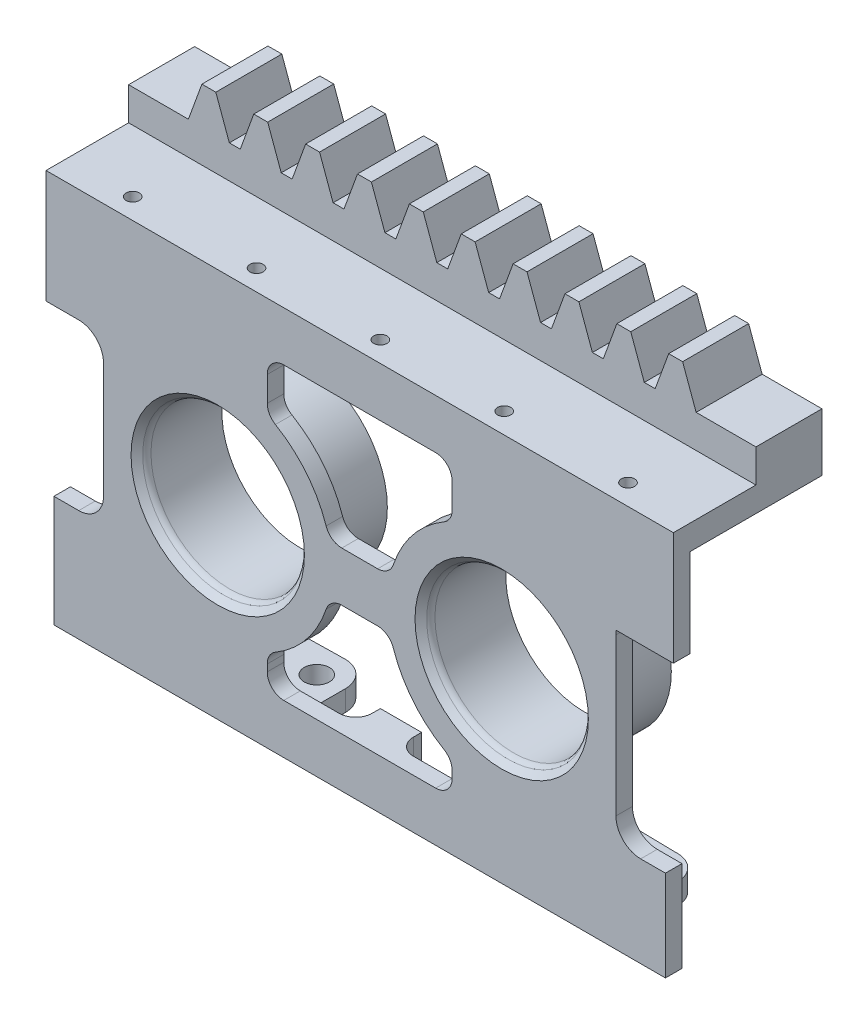
from build123d import *

# Parameters (mm, degrees)
SKETCH1_W              = 213.628300444
SKETCH1_H              = 8
EXTRUDE1_DEPTH         = 8
EXTRUDE2_DEPTH         = 8
LPATTERN1_COUNT        = 34
LPATTERN1_PITCH        = 6.283185307
SKETCH_1_W             = 139.55181824
SKETCH_1_H             = 28
CUT_EXTRUDE_1_DEPTH    = 10
SKETCH_2_W             = 4.961443825
SKETCH_2_H             = 8
CUT_EXTRUDE_2_DEPTH    = 10
SKETCH_3_W             = 74.076482204
SKETCH_3_H             = 1
CUT_EXTRUDE_3_DEPTH    = 10
SKETCH_4_W             = 74.076482204
SKETCH_4_H             = 2
EXTRUDE_1_DEPTH        = 8
SKETCH_5_W             = 74.076482204
SKETCH_5_H             = 45.4
EXTRUDE_2_DEPTH        = 2
SKETCH_6_R             = 1.525
EXTRUDE_3_DEPTH        = 1.7
SKETCH_7_R             = 10.55
SKETCH_7_R_2           = 9.5
EXTRUDE_4_DEPTH        = 10
CUT_EXTRUDE_START      = -7
SKETCH_8_R             = 9.5
CUT_EXTRUDE_4_DEPTH    = 7
SKETCH_9_W             = 12
SKETCH_9_H             = 20
SKETCH_9_H_2           = 25
CUT_EXTRUDE_5_DEPTH    = 7
FILLET_1_R             = 3
EXTRUDE_START          = 0.8
SKETCH_13_R            = 1.525
EXTRUDE_7_DEPTH        = 0.8
EXTRUDE_8_DEPTH        = 75.038241102
EXTRUDE_9_DEPTH        = 75.038241102
SKETCH_16_W            = 76
SKETCH_16_H            = 10
EXTRUDE_10_DEPTH       = 1
SKETCH_17_W            = 5
SKETCH_17_H            = 5
EXTRUDE_11_DEPTH       = 6
HOLE_WIZARD_M2_1_D     = 1.6
HOLE_WIZARD_M2_1_DEPTH = 5.2
HOLE_WIZARD_M2_1_TIP   = 0.480688495
FILLET_3_R             = 2
HOLE_WIZARD_M2_2_D     = 1.6
HOLE_WIZARD_M2_2_DEPTH = 5.2
HOLE_WIZARD_M2_2_TIP   = 0.480688495
CHAMFER_1_SIZE         = 1
FILLET_5_R             = 1
CUT_EXTRUDE_6_DEPTH    = 10
EXTRUDE_12_DEPTH       = 2
FILLET_6_R             = 2


with BuildPart() as part:
    # Sketch1 → Extrude1 (new body)
    with BuildSketch(Plane.XY):
        with Locations((106.814150222, -4)):
            Rectangle(SKETCH1_W, SKETCH1_H)
    extrude(amount=EXTRUDE1_DEPTH)

    # Sketch2 → Extrude2 (add)
    with BuildSketch(Plane.XY.offset(8)):
        Polygon((0, 0), (1.637866054, 4.5), (3.323577771, 4.5), (4.961443825, 0), align=None)
    extrude2 = extrude(amount=-EXTRUDE2_DEPTH)

    # LPattern1: Extrude2 ×34
    with Locations(*[(i * LPATTERN1_PITCH, 0, 0) for i in range(1, LPATTERN1_COUNT)]):
        add(extrude2)

    # 草图1 → 切除-拉伸1 (cut)
    with BuildSketch(Plane.XY.offset(8)):
        with Locations((143.852391324, 6)):
            Rectangle(SKETCH_1_W, SKETCH_1_H)
    extrude(amount=-CUT_EXTRUDE_1_DEPTH, mode=Mode.SUBTRACT)

    # 草图2 → 切除-拉伸2 (cut)
    with BuildSketch(Plane(origin=(0, 0, 0), x_dir=(1, 0, 0), z_dir=(0, 1, 0))):
        with Locations((2.480721912, -4)):
            Rectangle(SKETCH_2_W, SKETCH_2_H)
        with Locations((71.595760291, -4)):
            Rectangle(SKETCH_2_W, SKETCH_2_H)
    extrude(amount=CUT_EXTRUDE_2_DEPTH, mode=Mode.SUBTRACT)

    # 草图3 → 切除-拉伸3 (cut)
    with BuildSketch(Plane.XY.offset(8)):
        with Locations((37.038241102, -7.5)):
            Rectangle(SKETCH_3_W, SKETCH_3_H)
    extrude(amount=-CUT_EXTRUDE_3_DEPTH, mode=Mode.SUBTRACT)

    # 草图4 → 凸台-拉伸1 (add)
    with BuildSketch(Plane.XY.offset(8)):
        with Locations((37.038241102, -6)):
            Rectangle(SKETCH_4_W, SKETCH_4_H)
    extrude(amount=EXTRUDE_1_DEPTH)

    # 草图5 → 凸台-拉伸2 (add)
    with BuildSketch(Plane.XY.offset(16)):
        with Locations((37.038241102, -27.7)):
            Rectangle(SKETCH_5_W, SKETCH_5_H)
    extrude(amount=EXTRUDE_2_DEPTH)

    # 草图6 → 凸台-拉伸3 (add)
    with BuildSketch(Plane.XZ.offset(50.4)):
        with BuildLine():
            Line((26.838241102, 9.55), (26.838241102, 18))
            Line((26.838241102, 18), (6.838241102, 18))
            Line((6.838241102, 18), (6.838241102, 9.698571137))
            ThreePointArc((6.838241102, 9.698571137), (7.698039013, 7.59630212), (9.784597782, 6.699050776))
            Line((9.784597782, 6.699050776), (23.682809671, 6.450495627))
            ThreePointArc((23.682809671, 6.450495627), (25.910585753, 7.338457842), (26.838241102, 9.55))
        make_face()
        with Locations(Location((10.038241102, 9.8, 0), (0, 0, 270))):
            Circle(SKETCH_6_R, mode=Mode.SUBTRACT)
        with Locations(Location((23.638241102, 9.8, 0), (0, 0, 270))):
            Circle(SKETCH_6_R, mode=Mode.SUBTRACT)
    extrude_3 = extrude(amount=-EXTRUDE_3_DEPTH)

    # 镜向1: 凸台-拉伸3 across plane
    add(extrude_3.mirror(Plane.ZY.offset(-37.038241102)))

    # 草图7 → 凸台-拉伸4 (add)
    # profile 1 of 2: a face of its own
    with BuildSketch(Plane.XY.offset(18)):
        with Locations((54.238241102, -28.7)):
            Circle(SKETCH_7_R)
        with Locations((54.238241102, -28.7)):
            Circle(SKETCH_7_R_2, mode=Mode.SUBTRACT)
    # profile 2 of 2: a face of its own
    with BuildSketch(Plane.XY.offset(18)):
        with Locations((19.838241102, -28.7)):
            Circle(SKETCH_7_R)
        with Locations((19.838241102, -28.7)):
            Circle(SKETCH_7_R_2, mode=Mode.SUBTRACT)
    extrude(amount=-EXTRUDE_4_DEPTH)

    # 草图8 → 切除-拉伸4 (cut)
    with BuildSketch(Plane(origin=(0, 0, 16), x_dir=(-1, 0, 0), z_dir=(0, 0, -1)).offset(CUT_EXTRUDE_START)):
        with Locations(Location((-19.838241102, -28.7, 0), (0, 0, 180))):
            Circle(SKETCH_8_R)
        with Locations(Location((-54.238241102, -28.7, 0), (0, 0, 180))):
            Circle(SKETCH_8_R)
    extrude(amount=CUT_EXTRUDE_4_DEPTH, mode=Mode.SUBTRACT)

    # 草图9 → 切除-拉伸5 (cut)
    with BuildSketch(Plane.XY.offset(18)):
        with Locations((0, -27.7)):
            Rectangle(SKETCH_9_W, SKETCH_9_H)
        with Locations((74.076482204, -27.7)):
            Rectangle(SKETCH_9_W, SKETCH_9_H_2)
    extrude(amount=-CUT_EXTRUDE_5_DEPTH, mode=Mode.SUBTRACT)

    # 圆角1
    fillet_1_edges = [part.edges().sort_by_distance(p)[0] for p in [
        (6, -17.7, 17),
        (6, -37.7, 17),
        (68.076482204, -40.2, 17),
        (68.076482204, -15.2, 17),
    ]]
    fillet(fillet_1_edges, radius=FILLET_1_R)

    # 草图13 → 凸台-拉伸7 (add)
    with BuildSketch(Plane.XZ.offset(50.4).offset(EXTRUDE_START)):
        with BuildLine():
            Line((74.076482204, 16), (74.076482204, 18))
            Line((74.076482204, 18), (0, 18))
            Line((0, 18), (0, 16))
            Line((0, 16), (6.838241102, 16))
            Line((6.838241102, 16), (6.838241102, 9.698571137))
            ThreePointArc((6.838241102, 9.698571137), (7.698039013, 7.59630212), (9.784597782, 6.699050776))
            Line((9.784597782, 6.699050776), (23.682809671, 6.450495627))
            ThreePointArc((23.682809671, 6.450495627), (25.910585753, 7.338457842), (26.838241102, 9.55))
            Line((26.838241102, 9.55), (26.838241102, 16))
            Line((26.838241102, 16), (47.238241102, 16))
            Line((47.238241102, 16), (47.238241102, 9.55))
            ThreePointArc((47.238241102, 9.55), (48.165896451, 7.338457842), (50.393672533, 6.450495627))
            Line((50.393672533, 6.450495627), (64.291884422, 6.699050776))
            ThreePointArc((64.291884422, 6.699050776), (66.378443191, 7.59630212), (67.238241102, 9.698571137))
            Line((67.238241102, 9.698571137), (67.238241102, 16))
            Line((67.238241102, 16), (74.076482204, 16))
        make_face()
        with Locations(Location((64.038241102, 9.8, 0), (0, 0, 270))):
            Circle(SKETCH_13_R, mode=Mode.SUBTRACT)
        with Locations(Location((50.438241102, 9.8, 0), (0, 0, 270))):
            Circle(SKETCH_13_R, mode=Mode.SUBTRACT)
        with Locations(Location((23.638241102, 9.8, 0), (0, 0, 270))):
            Circle(SKETCH_13_R, mode=Mode.SUBTRACT)
        with Locations(Location((10.038241102, 9.8, 0), (0, 0, 270))):
            Circle(SKETCH_13_R, mode=Mode.SUBTRACT)
    extrude(amount=-EXTRUDE_7_DEPTH)

    # 草图14 → 凸台-拉伸8 (add)
    with BuildSketch(Plane.ZY):
        Polygon((16, -7), (16, -17.7), (18, -17.7), (18, -5), (8, -5), (8, 0), (0, 0), (0, -7), align=None)
    extrude(amount=-EXTRUDE_8_DEPTH)

    # 草图15 → 凸台-拉伸9 (add)
    with BuildSketch(Plane(origin=(74.076482204, 0, 0), x_dir=(0, 0, -1), z_dir=(1, 0, 0))):
        Polygon((-16, -7), (0, -7), (0, 0), (-8, 0), (-8, -5), (-18, -5), (-18, -17.7), (-16, -17.7), align=None)
    extrude(amount=-EXTRUDE_9_DEPTH)

    # 草图16 → 凸台-拉伸10 (add)
    with BuildSketch(Plane(origin=(0, -5, 0), x_dir=(1, 0, 0), z_dir=(0, 1, 0))):
        with Locations((37.038241102, -13)):
            Rectangle(SKETCH_16_W, SKETCH_16_H)
    extrude(amount=EXTRUDE_10_DEPTH)

    # 草图17 → 凸台-拉伸11 (add)
    with BuildSketch(Plane.XZ.offset(51.2)):
        with Locations((37.038241102, 15.5)):
            Rectangle(SKETCH_17_W, SKETCH_17_H)
    extrude(amount=-EXTRUDE_11_DEPTH)

    # M2 螺纹孔1
    with Locations(Plane(origin=(0, -51.2, 0), x_dir=(-1, 0, 0), z_dir=(0, -1, 0))):
        with Locations((-22.038241102, -15.5), (-52.038241102, -15.5), (-37.038241102, -15.5)):
            Hole(HOLE_WIZARD_M2_1_D / 2, depth=HOLE_WIZARD_M2_1_DEPTH)
            with Locations((0, 0, -(HOLE_WIZARD_M2_1_DEPTH + HOLE_WIZARD_M2_1_TIP / 2))):  # 118° drill point
                Cone(0, HOLE_WIZARD_M2_1_D / 2, HOLE_WIZARD_M2_1_TIP, mode=Mode.SUBTRACT)

    # 圆角3
    fillet_3_edges = [part.edges().sort_by_distance(p)[0] for p in [
        (34.538241102, -47.8, 16),
        (39.538241102, -47.8, 16),
    ]]
    fillet(fillet_3_edges, radius=FILLET_3_R)

    # M2 螺纹孔2
    with Locations(Plane(origin=(0, -4, 0), x_dir=(1, 0, 0), z_dir=(0, 1, 0))):
        with Locations((7.038241102, -15.5), (22.038241102, -15.5), (37.038241102, -15.5), (52.038241102, -15.5), (67.038241102, -15.5)):
            Hole(HOLE_WIZARD_M2_2_D / 2, depth=HOLE_WIZARD_M2_2_DEPTH)
            with Locations((0, 0, -(HOLE_WIZARD_M2_2_DEPTH + HOLE_WIZARD_M2_2_TIP / 2))):  # 118° drill point
                Cone(0, HOLE_WIZARD_M2_2_D / 2, HOLE_WIZARD_M2_2_TIP, mode=Mode.SUBTRACT)

    # 倒角1
    chamfer_1_edges = [part.edges().sort_by_distance(p)[0] for p in [
        (10.338241102, -28.7, 18),
        (44.738241102, -28.7, 18),
    ]]
    chamfer(chamfer_1_edges, length=CHAMFER_1_SIZE)

    # 圆角5
    fillet_5_edges = [part.edges().sort_by_distance(p)[0] for p in [
        (10.338241102, -28.7, 17),
        (44.738241102, -28.7, 17),
    ]]
    fillet(fillet_5_edges, radius=FILLET_5_R)

    # 草图25 → 切除-拉伸6 (cut)
    with BuildSketch(Plane(origin=(0, 0, 16), x_dir=(-1, 0, 0), z_dir=(0, 0, -1))):
        with BuildLine():
            Line((-48.238241102, -16.230159713), (-48.238241102, -10))
            Line((-48.238241102, -10), (-25.838241102, -10))
            Line((-25.838241102, -10), (-25.838241102, -16.230159713))
            ThreePointArc((-25.838241102, -16.230159713), (-33.676482204, -28.7), (-25.838241102, -41.169840287))
            Line((-25.838241102, -41.169840287), (-25.838241102, -45.2))
            Line((-25.838241102, -45.2), (-48.238241102, -45.2))
            Line((-48.238241102, -45.2), (-48.238241102, -41.169840287))
            ThreePointArc((-48.238241102, -41.169840287), (-40.4, -28.7), (-48.238241102, -16.230159713))
        make_face()
    extrude(amount=-CUT_EXTRUDE_6_DEPTH, mode=Mode.SUBTRACT)

    # 草图26 → 凸台-拉伸12 (add)
    with BuildSketch(Plane(origin=(0, 0, 16), x_dir=(-1, 0, 0), z_dir=(0, 0, -1))):
        with BuildLine():
            Line((-40.729099131, -31.7), (-33.347383073, -31.7))
            ThreePointArc((-33.347383073, -31.7), (-33.676482204, -28.7), (-33.347383073, -25.7))
            Line((-33.347383073, -25.7), (-40.729099131, -25.7))
            ThreePointArc((-40.729099131, -25.7), (-40.4, -28.7), (-40.729099131, -31.7))
        make_face()
    extrude(amount=-EXTRUDE_12_DEPTH)

    # 圆角6
    # the kernel refuses this fillet: 2 mm, written as the material it adds along each edge
    with BuildSketch(Plane(origin=(48.238241102, -41.169840287, 16), x_dir=(-0.8828104282745606, 0.46972944098670955, 0), z_dir=(0, 0, 1)), Plane(origin=(25.838241102, -16.230159713, 16), x_dir=(0.8828104282745575, -0.4697294409867159, 0), z_dir=(0, 0, 1))) as fillet_6_piece_1:
        with BuildLine():
            CenterArc((1.202197277, 1.998358258), FILLET_6_R, 208.016735399, 59.66157151)
            Line((-0.56342358, 1.058899376), (0, 0))
            ThreePointArc((0, 0), (0.560588538, 0.011359411), (1.121177076, 0))
        make_face()
    extrude(amount=2)
    with BuildSketch(Plane(origin=(48.238241102, -16.230159713, 16), x_dir=(0, 1, 0), z_dir=(0, 0, 1))) as fillet_6_piece_2:
        with BuildLine():
            CenterArc((1.199464055, 2), FILLET_6_R, 210.33842849, 59.66157151)
            ThreePointArc((-0.526649881, 0.989786814), (-0.253296734, 0.500229257), (0, 0))
            Line((0, 0), (1.199464055, 0))
        make_face()
    extrude(amount=2)
    with BuildSketch(Plane(origin=(48.238241102, -10, 16), x_dir=(-1, 0, 0), z_dir=(0, 0, 1)), Plane(origin=(25.838241102, -10, 16), x_dir=(0, -1, 0), z_dir=(0, 0, 1)), Plane(origin=(25.838241102, -45.2, 16), x_dir=(1, 0, 0), z_dir=(0, 0, 1)), Plane(origin=(48.238241102, -45.2, 16), x_dir=(0, 1, 0), z_dir=(0, 0, 1))) as fillet_6_piece_3:
        with BuildLine():
            CenterArc((FILLET_6_R, FILLET_6_R), FILLET_6_R, 180, 90)
            Line((0, FILLET_6_R), (0, 0))
            Line((0, 0), (FILLET_6_R, 0))
        make_face()
    extrude(amount=2)
    with BuildSketch(Plane(origin=(25.838241102, -41.169840287, 16), x_dir=(0.8828104282745567, 0.4697294409867172, 0), z_dir=(0, 0, 1))) as fillet_6_piece_4:
        with BuildLine():
            CenterArc((1.202197277, -1.998358258), FILLET_6_R, 92.321693091, 59.66157151)
            Line((-0.56342358, -1.058899376), (0, 0))
            ThreePointArc((0, 0), (0.560588538, -0.011359411), (1.121177076, 0))
        make_face()
    extrude(amount=2)
    with BuildSketch(Plane(origin=(33.347383073, -31.7, 16), x_dir=(-0.26659221504284825, -0.9638094162636863, 0), z_dir=(0, 0, 1)), Plane(origin=(40.729099131, -25.7, 16), x_dir=(0.2665922150428596, 0.9638094162636831, 0), z_dir=(0, 0, 1))) as fillet_6_piece_5:
        with BuildLine():
            CenterArc((1.522622416, 1.997365818), FILLET_6_R, 195.461583965, 71.597428665)
            Line((-0.404996416, 1.464181388), (0, 0))
            ThreePointArc((0, 0), (0.710003833, 0.018226219), (1.420007665, 0))
        make_face()
    extrude(amount=2)
    with BuildSketch(Plane(origin=(33.347383073, -25.7, 16), x_dir=(-0.26659221504285097, 0.9638094162636855, 0), z_dir=(0, 0, 1)), Plane(origin=(40.729099131, -31.7, 16), x_dir=(0.2665922150428484, -0.9638094162636862, 0), z_dir=(0, 0, 1))) as fillet_6_piece_6:
        with BuildLine():
            CenterArc((1.522622416, -1.997365818), FILLET_6_R, 92.94098737, 71.597428665)
            Line((-0.404996416, -1.464181388), (0, 0))
            ThreePointArc((0, 0), (0.710003833, -0.018226219), (1.420007665, 0))
        make_face()
    extrude(amount=2)


solid = part.part
